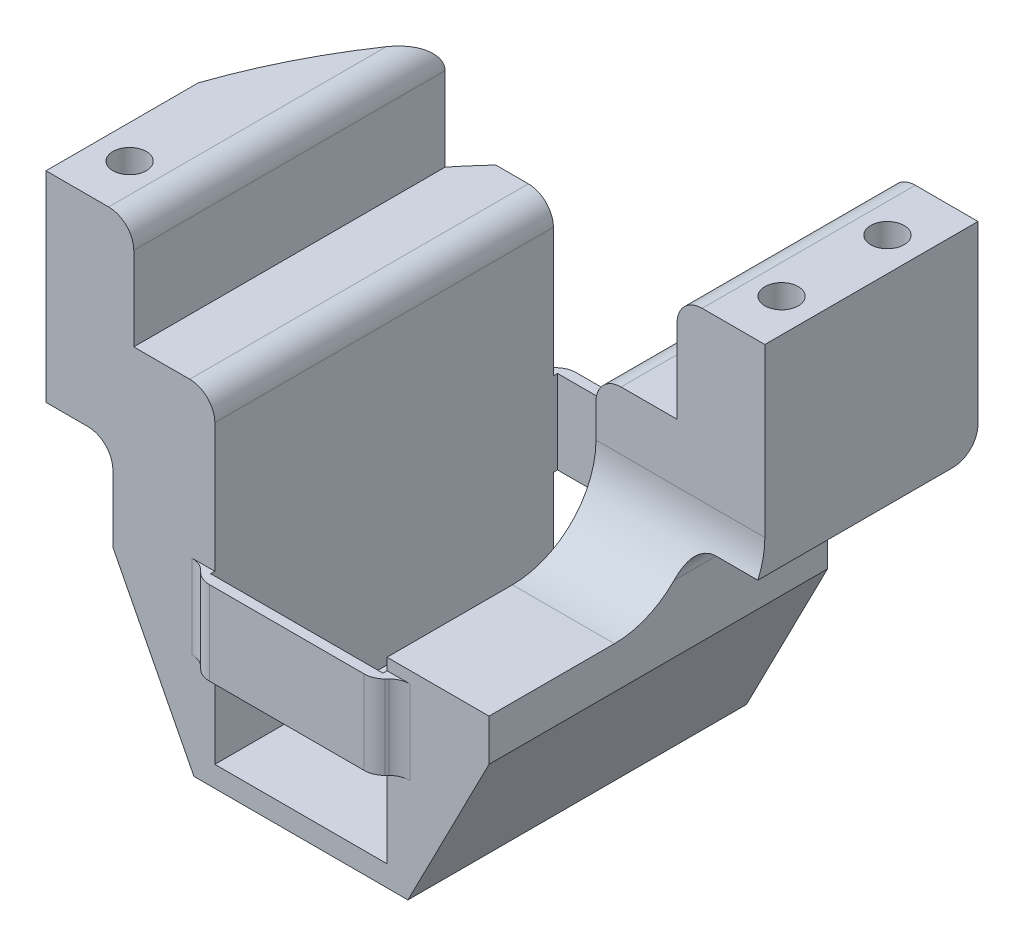
from build123d import *

# Parameters (mm, degrees)
BOSS_EXTRUDE1_DEPTH     = 40.5
SKETCH3_W               = 20.2
SKETCH3_H               = 25
CUT_EXTRUDE1_DEPTH      = 30
FILLET1_R               = 10
BOSS_EXTRUDE2_DEPTH     = 10
FILLET2_R               = 2.5
BOSS_EXTRUDE4_DEPTH     = 10
CUT_EXTRUDE2_DEPTH      = 80.910637628
CUT_EXTRUDE2_DEPTH_BACK = 80.910637628
SKETCH6_OUTSIDE_W       = 82.34
SKETCH6_OUTSIDE_H       = 73.54
SKETCH6_OUTSIDE_R       = 62.5
FILLET4_START           = 10.236401345
FILLET4_DEPTH           = 11.787009985
FILLET4_START_2         = 9.761256766
FILLET4_2_DEPTH         = 15.202960338
FILLET4_START_3         = -47
FILLET4_3_DEPTH         = 6.5
CUT_EXTRUDE3_DEPTH      = 67.140078667
CUT_EXTRUDE3_DEPTH_BACK = 67.140078667
SKETCH7_R               = 2
SKETCH9_R               = 4
CUT_EXTRUDE4_DEPTH      = 67.140078667
FILLET5_R               = 3


with BuildPart() as part:
    # Sketch2 → Boss-Extrude1 (new body)
    with BuildSketch(Plane.XY):
        with BuildLine():
            Line((-22.5, 23.9), (-22.5, 15.9))
            Line((-22.5, 15.9), (-12.8, -3))
            Line((-12.8, -3), (12.8, -3))
            Line((12.8, -3), (22.5, 15.9))
            Line((22.5, 15.9), (22.5, 23.9))
            ThreePointArc((22.5, 23.9), (23.378679656, 26.021320344), (25.5, 26.9))
            Line((25.5, 26.9), (30.5, 26.9))
            Line((30.5, 26.9), (30.5, 50.9))
            Line((30.5, 50.9), (23, 50.9))
            ThreePointArc((23, 50.9), (20.878679656, 50.021320344), (20, 47.9))
            Line((20, 47.9), (20, 37.9))
            Line((20, 37.9), (13.3, 37.9))
            ThreePointArc((13.3, 37.9), (11.178679656, 37.021320344), (10.3, 34.9))
            Line((10.3, 34.9), (10.3, -0.5))
            Line((10.3, -0.5), (-10.3, -0.5))
            Line((-10.3, -0.5), (-10.3, 34.9))
            ThreePointArc((-10.3, 34.9), (-11.178679656, 37.021320344), (-13.3, 37.9))
            Line((-13.3, 37.9), (-20, 37.9))
            Line((-20, 37.9), (-20, 47.9))
            ThreePointArc((-20, 47.9), (-20.878679656, 50.021320344), (-23, 50.9))
            Line((-23, 50.9), (-30.5, 50.9))
            Line((-30.5, 50.9), (-30.5, 26.9))
            Line((-30.5, 26.9), (-25.5, 26.9))
            ThreePointArc((-25.5, 26.9), (-23.378679656, 26.021320344), (-22.5, 23.9))
        make_face()
    extrude(amount=-BOSS_EXTRUDE1_DEPTH)

    # Sketch3 → Cut-Extrude1 (cut)
    with BuildSketch(Plane(origin=(0, 50.9, 0), x_dir=(1, 0, 0), z_dir=(0, 1, 0))):
        with Locations((20.4, 12.5)):
            Rectangle(SKETCH3_W, SKETCH3_H)
    extrude(amount=-CUT_EXTRUDE1_DEPTH, mode=Mode.SUBTRACT)

    # Fillet1
    fillet1_edges = [part.edges().sort_by_distance(p)[0] for p in [
        (16.4, 20.9, -25),
    ]]
    fillet(fillet1_edges, radius=FILLET1_R)

    # Sketch4 → Boss-Extrude2 (add)
    with BuildSketch(Plane(origin=(0, 9.5, 0), x_dir=(-1, 0, 0), z_dir=(0, -1, 0))):
        Polygon((-10.3, -1.7), (-12, 0), (-10.3, 0), (-10.3, -0.5), (10.3, -0.5), (10.3, 0), (12, 0), (10.3, -1.7), align=None)
    boss_extrude2 = extrude(amount=-BOSS_EXTRUDE2_DEPTH)

    # Mirror1: Boss-Extrude2 across plane
    add(boss_extrude2.mirror(Plane(origin=(-30.5, 50.9, -20.25), x_dir=(1, 0, 0), z_dir=(0, 0, 1))))

    # Fillet2
    fillet2_edges = [part.edges().sort_by_distance(p)[0] for p in [
        (10.3, 14.5, 1.7),
        (12, 14.5, 0),
        (-12, 14.5, 0),
        (-10.3, 14.5, 1.7),
        (12, 14.5, -40.5),
        (10.3, 14.5, -42.2),
        (-10.3, 14.5, -42.2),
        (-12, 14.5, -40.5),
    ]]
    fillet(fillet2_edges, radius=FILLET2_R)

    # Sketch5 → Boss-Extrude4 (add)
    with BuildSketch(Plane(origin=(0, 0, -40.5), x_dir=(-1, 0, 0), z_dir=(0, 0, -1))):
        with BuildLine():
            Line((-10.3, 27.2), (-10.3, 34.9))
            ThreePointArc((-10.3, 34.9), (-11.178679656, 37.021320344), (-13.3, 37.9))
            Line((-13.3, 37.9), (-20, 37.9))
            Line((-20, 37.9), (-20, 47.9))
            ThreePointArc((-20, 47.9), (-20.878679656, 50.021320344), (-23, 50.9))
            Line((-23, 50.9), (-30.5, 50.9))
            Line((-30.5, 50.9), (-30.5, 26.9))
            Line((-30.5, 26.9), (-25.5, 26.9))
            Line((-25.5, 26.9), (-10.3, 27.2))
        make_face()
    extrude(amount=BOSS_EXTRUDE4_DEPTH)

    # Sketch6 outside → Cut-Extrude2 (cut, two sides: drawn at the far end of the back side and taken through both)
    with BuildSketch(Plane.XZ.offset(3).offset(-CUT_EXTRUDE2_DEPTH_BACK)):
        with Locations((0, -24.4)):
            Rectangle(SKETCH6_OUTSIDE_W, SKETCH6_OUTSIDE_H)
        with Locations((28.643393778, 1.99070872)):
            Circle(SKETCH6_OUTSIDE_R, mode=Mode.SUBTRACT)
    extrude(amount=CUT_EXTRUDE2_DEPTH + CUT_EXTRUDE2_DEPTH_BACK, mode=Mode.SUBTRACT)

    # Fillet4: read off the stored shape, not the designer's step
    # Fillet4 outline → Fillet4 (add)
    with BuildSketch(Plane(origin=(0, 0, 0), x_dir=(0.019732999054288013, 0.9998052854172774, 0), z_dir=(0.9998052854172774, -0.01973299905428801, 0)).offset(FILLET4_START)):
        with BuildLine():
            ThreePointArc((22.397953654, -40.5), (25.93348756, -41.964466094), (27.397953654, -45.5))
            Line((27.397953654, -45.5), (27.397953654, -40.5))
            Line((27.397953654, -40.5), (22.397953654, -40.5))
        make_face()
    extrude(amount=FILLET4_DEPTH)

    # Fillet4 2 outline → Fillet4 2 (add)
    with BuildSketch(Plane(origin=(0, 0, 0), x_dir=(0.019732999054288013, 0.9998052854172774, 0), z_dir=(0.9998052854172774, -0.01973299905428801, 0)).offset(FILLET4_START_2)):
        with BuildLine():
            ThreePointArc((22.397953654, -40.5), (25.93348756, -41.964466094), (27.397953654, -45.5))
            Line((27.397953654, -45.5), (27.397953654, -40.5))
            Line((27.397953654, -40.5), (22.397953654, -40.5))
        make_face()
    extrude(amount=FILLET4_2_DEPTH)

    # Fillet4 3 outline → Fillet4 3 (cut)
    with BuildSketch(Plane.XY.offset(FILLET4_START_3)):
        with BuildLine():
            Line((25.401335005, 21.900973573), (25.5, 26.9))
            ThreePointArc((25.5, 26.9), (23.378679656, 26.021320344), (22.5, 23.9))
            Line((22.5, 23.9), (22.5, 21.958236764))
            Line((22.5, 21.958236764), (25.401335005, 21.900973573))
        make_face()
        Polygon((10.3, 22.199026238), (10.3, 27.2), (10.201334905, 22.200973575), align=None)
    extrude(amount=FILLET4_3_DEPTH, mode=Mode.SUBTRACT)

    # Sketch7 → Cut-Extrude3 (cut, two sides: drawn at the far end of the back side and taken through both)
    with BuildSketch(Plane.XZ.offset(-26.9).offset(-CUT_EXTRUDE3_DEPTH_BACK)):
        with Locations(Location((26.5, -31, 0), (0, 0, 270))):
            Circle(SKETCH7_R)
        with Locations(Location((-26.5, -6, 0), (0, 0, 270))):
            Circle(SKETCH7_R)
        with Locations(Location((26.5, -43.66515139, 0), (0, 0, 240))):
            Circle(SKETCH7_R)
    extrude(amount=CUT_EXTRUDE3_DEPTH + CUT_EXTRUDE3_DEPTH_BACK, mode=Mode.SUBTRACT)

    # Sketch9 → Cut-Extrude4 (cut, through all)
    with BuildSketch(Plane.XZ.offset(-26.9)):
        with Locations((-26.5, -6)):
            Circle(SKETCH9_R)
        with Locations((26.5, -31)):
            Circle(SKETCH9_R)
        with Locations((26.5, -43.66515139)):
            Circle(SKETCH9_R)
    extrude(amount=CUT_EXTRUDE4_DEPTH, mode=Mode.SUBTRACT)

    # Fillet5
    fillet5_edges = [part.edges().sort_by_distance(p)[0] for p in [
        (28, 26.9, -50.5),
        (17.9, 27.05, -50.5),
    ]]
    fillet(fillet5_edges, radius=FILLET5_R)


solid = part.part
